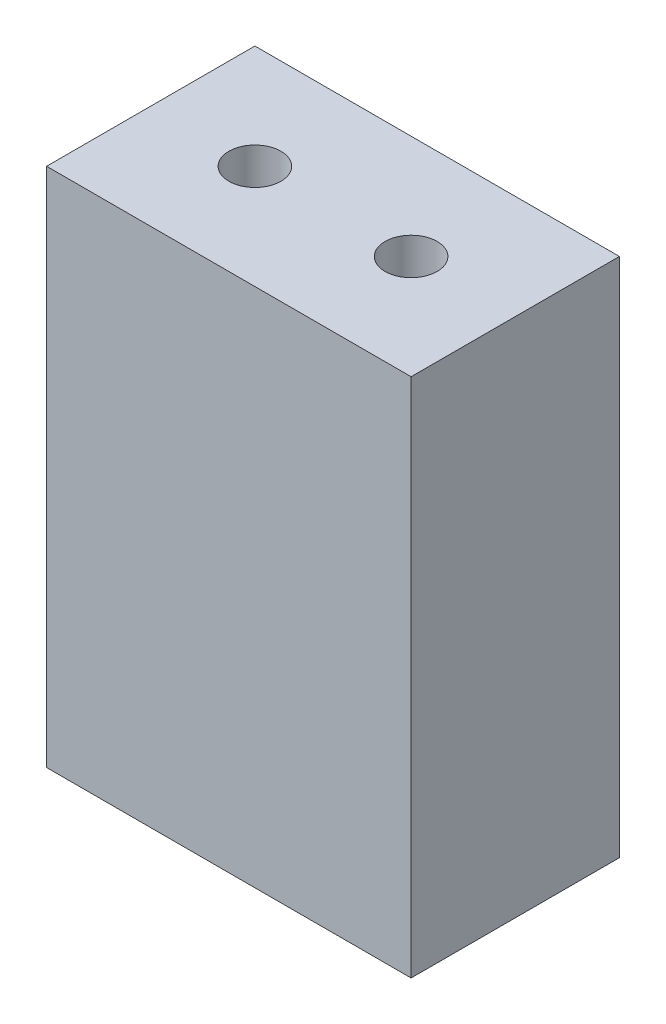
from build123d import *

# Parameters (mm, degrees)
BOSS_EXTRUDE1_DEPTH      = 25
BOSS_EXTRUDE1_DEPTH_BACK = 25
SKETCH1_W                = 35
SKETCH1_H                = 20
CUT_EXTRUDE1_DEPTH       = 54.909646632
CUT_EXTRUDE1_DEPTH_BACK  = 54.909646632
SKETCH2_R                = 2.5


with BuildPart() as part:
    # Sketch1 → Boss-Extrude1 (new, two sides: drawn at the far end of the back side and taken through both)
    with BuildSketch(Plane(origin=(0, 0, 0), x_dir=(1, 0, 0), z_dir=(0, 1, 0)).offset(-BOSS_EXTRUDE1_DEPTH_BACK)):
        Rectangle(SKETCH1_W, SKETCH1_H)
    extrude(amount=BOSS_EXTRUDE1_DEPTH + BOSS_EXTRUDE1_DEPTH_BACK)

    # Sketch2 → Cut-Extrude1 (cut, two sides: drawn at the far end of the back side and taken through both)
    with BuildSketch(Plane(origin=(0, 25, 0), x_dir=(1, 0, 0), z_dir=(0, 1, 0)).offset(-CUT_EXTRUDE1_DEPTH_BACK)):
        with Locations((-7.5, 0)):
            Circle(SKETCH2_R)
        with Locations((7.5, 0)):
            Circle(SKETCH2_R)
    extrude(amount=CUT_EXTRUDE1_DEPTH + CUT_EXTRUDE1_DEPTH_BACK, mode=Mode.SUBTRACT)


solid = part.part
